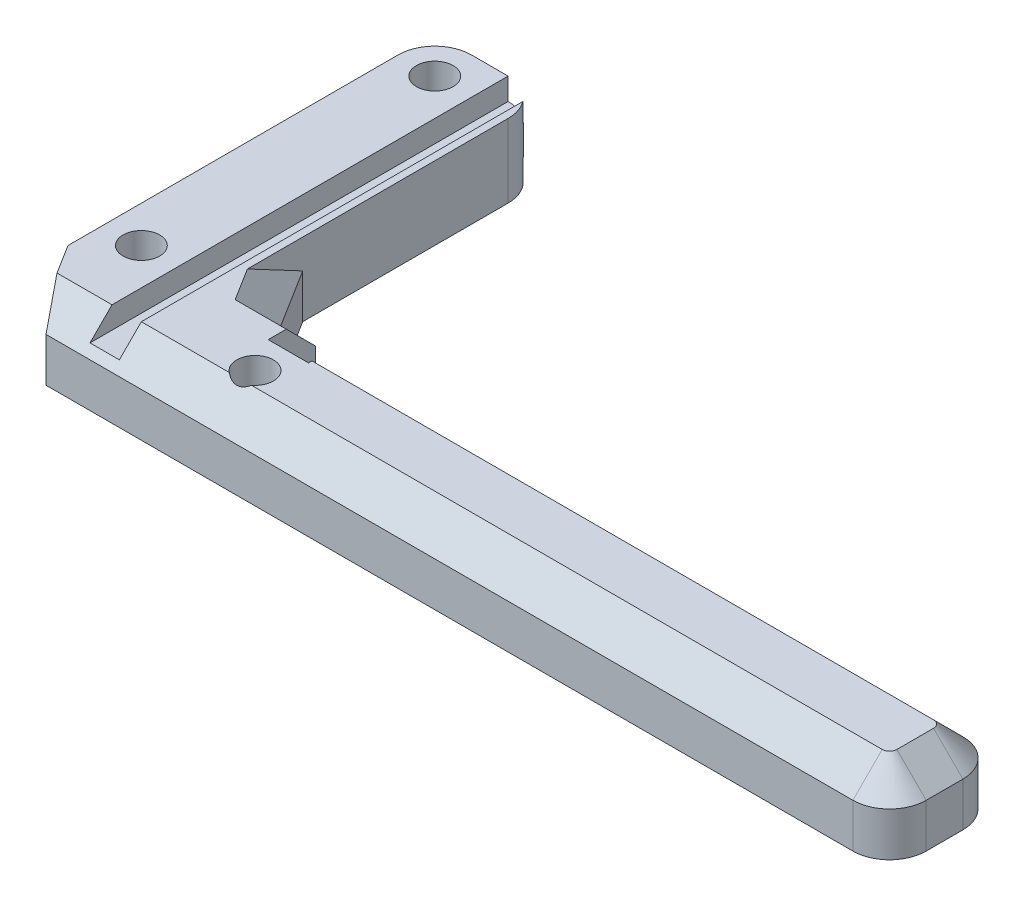
from build123d import *

# Parameters (mm, degrees)
SKETCH1_R           = 2.5
BOSS_EXTRUDE1_DEPTH = 10
SKETCH2_W           = 4
SKETCH2_H           = 61.321004691
CUT_EXTRUDE1_DEPTH  = 3
FILLET1_R           = 5
CHAMFER2_SIZE       = 4
CHAMFER3_SIZE       = 4
SKETCH3_R           = 2.5
CUT_EXTRUDE2_DEPTH  = 10


with BuildPart() as part:
    # Sketch1 → Boss-Extrude1 (new body)
    with BuildSketch(Plane(origin=(0, 0, 0), x_dir=(1, 0, 0), z_dir=(0, 1, 0))):
        Polygon((0, -25), (0, 25), (15, 25), (15, -8), (20, -16), (24.76, -16), (24.76, -22.47), (30.26, -22.47), (30.26, -18), (35, -18), (120, -18), (120, -33), (5, -33), align=None)
        with Locations((5, 20)):
            Circle(SKETCH1_R, mode=Mode.SUBTRACT)
        with Locations((5, -20)):
            Circle(SKETCH1_R, mode=Mode.SUBTRACT)
    extrude(amount=BOSS_EXTRUDE1_DEPTH)

    # Sketch2 → Cut-Extrude1 (cut)
    with BuildSketch(Plane(origin=(0, 10, 0), x_dir=(1, 0, 0), z_dir=(0, 1, 0))):
        with Locations((12, -5.660502345)):
            Rectangle(SKETCH2_W, SKETCH2_H)
    extrude(amount=-CUT_EXTRUDE1_DEPTH, mode=Mode.SUBTRACT)

    # Fillet1
    fillet1_edges = [part.edges().sort_by_distance(p)[0] for p in [
        (120, 5, 33),
        (120, 5, 18),
        (0, 5, -25),
        (15, 5, -25),
    ]]
    fillet(fillet1_edges, radius=FILLET1_R)

    # Chamfer2
    chamfer2_edges = [part.edges().sort_by_distance(p)[0] for p in [
        (118.535533906, 10, 31.535533906),
        (120, 10, 25.5),
        (118.535533906, 10, 19.464466094),
        (72.63, 10, 18),
        (64.5, 10, 33),
    ]]
    chamfer(chamfer2_edges, length=CHAMFER2_SIZE)

    # Chamfer3
    chamfer3_edges = [part.edges().sort_by_distance(p)[0] for p in [
        (22.38, 10, 16),
        (17.5, 10, 12),
    ]]
    chamfer(chamfer3_edges, length=CHAMFER3_SIZE)

    # Sketch3 → Cut-Extrude2 (cut)
    with BuildSketch(Plane(origin=(0, 10, 0), x_dir=(1, 0, 0), z_dir=(0, 1, 0))):
        with Locations((27.5, -27)):
            Circle(SKETCH3_R)
    extrude(amount=-CUT_EXTRUDE2_DEPTH, mode=Mode.SUBTRACT)


solid = part.part
